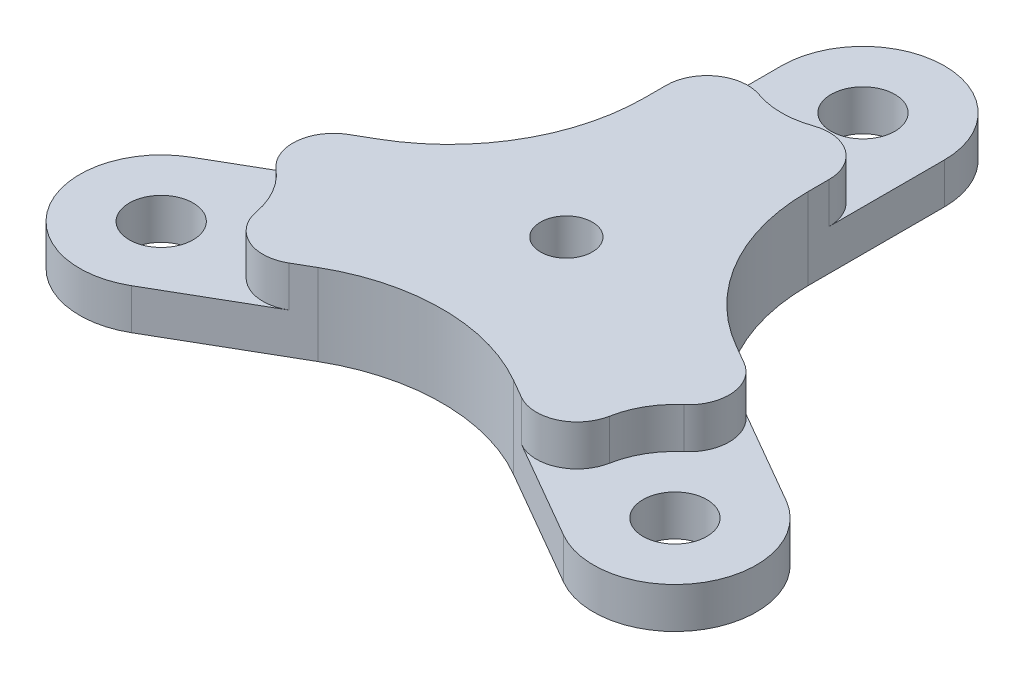
from build123d import *

# Parameters (mm, degrees)
SKETCH1_R           = 2.0193
SKETCH1_R_2         = 2.4892
BOSS_EXTRUDE1_DEPTH = 3.175
SKETCH3_R           = 6.35
SKETCH3_R_2         = 2.4892
CUT_EXTRUDE1_DEPTH  = 3.175
CIRPATTERN1_COUNT   = 3
FILLET3_R           = 15.24
FILLET2_DEPTH       = 3.175


with BuildPart() as part:
    # Sketch1 → Boss-Extrude1 (new, symmetric)
    with BuildSketch(Plane(origin=(0, 0, 0), x_dir=(1, 0, 0), z_dir=(0, 1, 0))):
        with BuildLine():
            Line((-6.35, 0), (-6.35, 23.114))
            ThreePointArc((-6.35, 23.114), (0, 29.464), (6.35, 23.114))
            Line((6.35, 23.114), (6.35, 0))
            ThreePointArc((6.35, 0), (0, -6.35), (-6.35, 0))
        make_face()
        with Locations(Location((0, 0, 0), (0, 0, 270))):
            Circle(SKETCH1_R, mode=Mode.SUBTRACT)
        with Locations(Location((0, 23.114, 0), (0, 0, 270))):
            Circle(SKETCH1_R_2, mode=Mode.SUBTRACT)
    boss_extrude1 = extrude(amount=BOSS_EXTRUDE1_DEPTH, both=True)

    # Sketch3 → Cut-Extrude1 (cut)
    with BuildSketch(Plane(origin=(0, 3.175, 0), x_dir=(1, 0, 0), z_dir=(0, 1, 0))):
        with Locations((0, 23.114)):
            Circle(SKETCH3_R)
        with Locations(Location((0, 23.114, 0), (0, 0, 270))):
            Circle(SKETCH3_R_2, mode=Mode.SUBTRACT)
    cut_extrude1 = extrude(amount=-CUT_EXTRUDE1_DEPTH, mode=Mode.SUBTRACT)

    # CirPattern1: Boss-Extrude1, Cut-Extrude1 ×3 about axis
    cirpattern1_axis = Axis((0, 0, 0), (0, 1, 0))
    add([boss_extrude1.rotate(cirpattern1_axis, i * 360 / CIRPATTERN1_COUNT) for i in range(1, CIRPATTERN1_COUNT)])
    add([cut_extrude1.rotate(cirpattern1_axis, i * 360 / CIRPATTERN1_COUNT) for i in range(1, CIRPATTERN1_COUNT)], mode=Mode.SUBTRACT)

    # Fillet3
    fillet3_edges = [part.edges().sort_by_distance(p)[0] for p in [
        (-6.35, 0, -3.666174209),
        (6.35, 0, -3.666174209),
        (0, 0, 7.332348419),
    ]]
    fillet(fillet3_edges, radius=FILLET3_R)

    # Fillet2: read off the stored shape, not the designer's step
    # Fillet2 outline → Fillet2 (cut)
    with BuildSketch(Plane(origin=(0, 0, 0), x_dir=(1, 0, 0), z_dir=(0, 1, 0))):
        with BuildLine():
            ThreePointArc((15.41518125, -1.567610625), (16.989288832, -4.025929604), (15.890891228, -6.730494188))
            ThreePointArc((15.890891228, -6.730494188), (19.434687828, -5.233784835), (23.192311183, -6.057738686))
            Line((23.192311183, -6.057738686), (15.41518125, -1.567610625))
        make_face()
        with BuildLine():
            ThreePointArc((16.842311183, -17.056261314), (14.249934539, -14.214040956), (13.774224561, -10.396668398))
            ThreePointArc((13.774224561, -10.396668398), (11.981201728, -12.700190919), (9.06518125, -12.566133253))
            Line((9.06518125, -12.566133253), (16.842311183, -17.056261314))
        make_face()
        with BuildLine():
            ThreePointArc((-9.06518125, -12.566133253), (-11.981201728, -12.700190919), (-13.774224561, -10.396668398))
            ThreePointArc((-13.774224561, -10.396668398), (-14.249934539, -14.214040956), (-16.842311183, -17.056261314))
            Line((-16.842311183, -17.056261314), (-9.06518125, -12.566133253))
        make_face()
        with BuildLine():
            ThreePointArc((-23.192311183, -6.057738686), (-19.434687828, -5.233784835), (-15.890891228, -6.730494188))
            ThreePointArc((-15.890891228, -6.730494188), (-16.989288832, -4.025929604), (-15.41518125, -1.567610625))
            Line((-15.41518125, -1.567610625), (-23.192311183, -6.057738686))
        make_face()
        with BuildLine():
            ThreePointArc((-6.35, 14.133743879), (-5.008087105, 16.726120523), (-2.116666667, 17.127162586))
            ThreePointArc((-2.116666667, 17.127162586), (-5.184753289, 19.447825791), (-6.35, 23.114))
            Line((-6.35, 23.114), (-6.35, 14.133743879))
        make_face()
        with BuildLine():
            ThreePointArc((2.116666667, 17.127162586), (5.008087105, 16.726120523), (6.35, 14.133743879))
            Line((6.35, 14.133743879), (6.35, 23.114))
            ThreePointArc((6.35, 23.114), (5.184753289, 19.447825791), (2.116666667, 17.127162586))
        make_face()
    extrude(amount=FILLET2_DEPTH, mode=Mode.SUBTRACT)


solid = part.part
